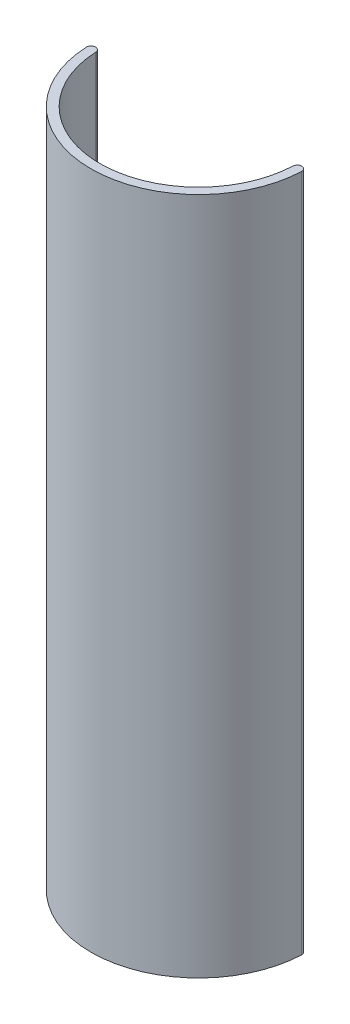
from build123d import *

# Parameters (mm, degrees)
BOSS_EXTRUDE1_DEPTH = 150
FILLET1_R           = 1


with BuildPart() as part:
    # Sketch1 → Boss-Extrude1 (new body)
    with BuildSketch(Plane(origin=(0, 0, 0), x_dir=(1, 0, 0), z_dir=(0, 1, 0))):
        with BuildLine():
            Line((-42, 0), (-40, 0))
            ThreePointArc((-40, 0), (-18.181666667, -21.818333333), (3.636666667, 0))
            Line((3.636666667, 0), (5.636666667, 0))
            ThreePointArc((5.636666667, 0), (-18.181666667, -23.818333333), (-42, 0))
        make_face()
    extrude(amount=BOSS_EXTRUDE1_DEPTH)

    # Fillet1
    fillet1_edges = [part.edges().sort_by_distance(p)[0] for p in [
        (5.636666667, 75, 0),
        (3.636666667, 75, 0),
        (-40, 75, 0),
        (-42, 75, 0),
    ]]
    fillet(fillet1_edges, radius=FILLET1_R - 0.0001)  # a hair under: the kernel refuses the full size


solid = part.part
